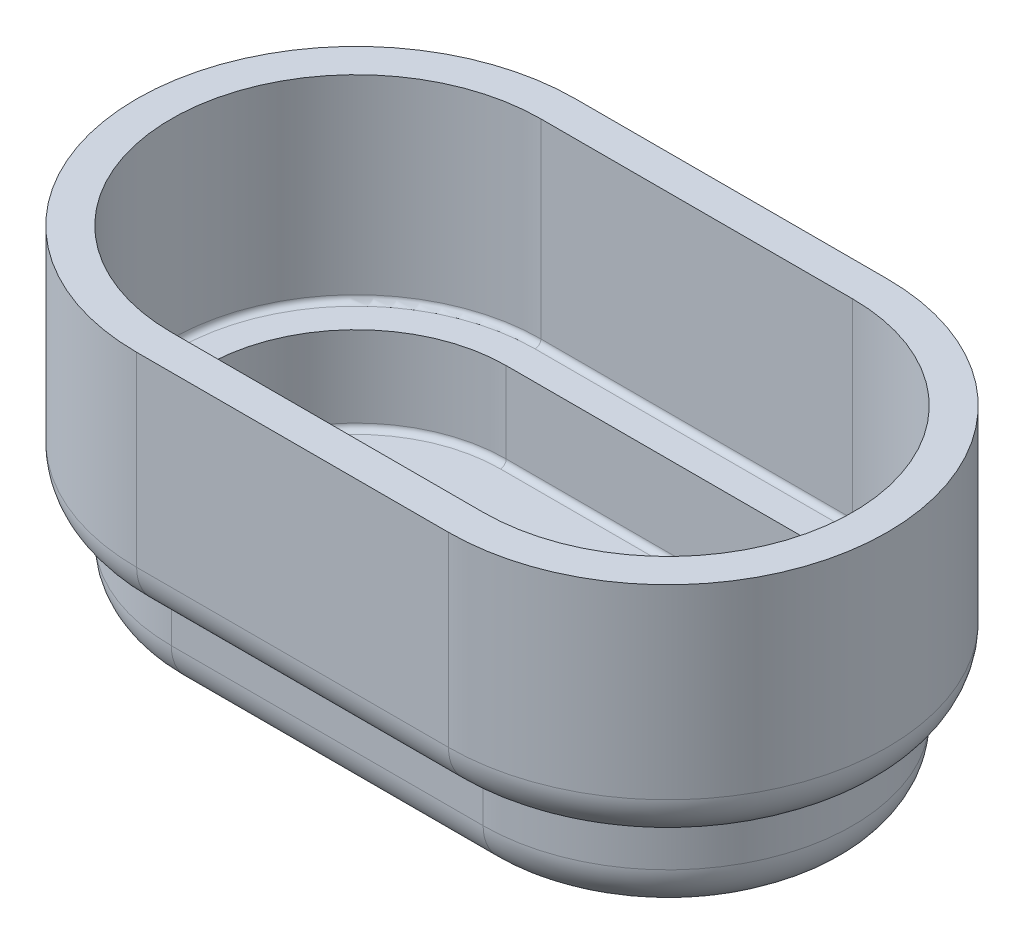
from build123d import *

# Parameters (mm, degrees)
EXTRUDE_1_DEPTH = 40
EXTRUDE_2_DEPTH = 55
SHELL_1_T       = -6
FILLET_1_R      = 8
FILLET_3_R      = 1


with BuildPart() as part:
    # 스케치1 → 보스-돌출1 (new body)
    with BuildSketch(Plane(origin=(0, 0, 0), x_dir=(1, 0, 0), z_dir=(0, 1, 0))):
        with BuildLine():
            Line((-23.342939481, 38), (30.657060519, 38))
            ThreePointArc((30.657060519, 38), (68.657060519, 0), (30.657060519, -38))
            Line((30.657060519, -38), (-23.342939481, -38))
            ThreePointArc((-23.342939481, -38), (-61.342939481, 0), (-23.342939481, 38))
        make_face()
    extrude(amount=-EXTRUDE_1_DEPTH)

    # 스케치1<3> → 보스-돌출2 (add)
    with BuildSketch(Plane(origin=(0, 0, 0), x_dir=(1, 0, 0), z_dir=(0, 1, 0))):
        with BuildLine():
            Line((-23.342939481, 32), (30.657060519, 32))
            ThreePointArc((30.657060519, 32), (62.657060519, 0), (30.657060519, -32))
            Line((30.657060519, -32), (-23.342939481, -32))
            ThreePointArc((-23.342939481, -32), (-55.342939481, 0), (-23.342939481, 32))
        make_face()
    extrude(amount=-EXTRUDE_2_DEPTH)

    # 쉘1
    shell_1_openings = [part.faces().sort_by_distance(p)[0] for p in [
        (3.657060519, 0, 0),
    ]]
    offset(amount=SHELL_1_T, openings=shell_1_openings, kind=Kind.INTERSECTION)

    # 필렛1
    # the kernel refuses this fillet: 8 mm, written as the material it takes off along each edge
    with BuildSketch(Plane(origin=(30.657060519, -40, 0), x_dir=(0, 0, -1), z_dir=(-1, 0, 0))) as fillet_1_piece_1:
        with BuildLine():
            CenterArc((30, -7.745966692), FILLET_1_R, 0, 75.522487814)
            Line((32, 0), (32.04, 0.154919334))
            ThreePointArc((32.04, 0.154919334), (35, 0.16), (38, 0.16))
            Line((38, 0.16), (38.16, 0))
            Line((38.16, 0), (38.16, -7.745966692))
            Line((38.16, -7.745966692), (38, -7.745966692))
        make_face()
    revolve(axis=Axis((30.657060519, -40, 0), (0, -1, 0)), revolution_arc=180, mode=Mode.SUBTRACT)
    with BuildSketch(Plane(origin=(-23.342939481, -40, -38), x_dir=(0, 0, 1), z_dir=(1, 0, 0))) as fillet_1_piece_2:
        with BuildLine():
            CenterArc((8, -7.745966692), FILLET_1_R, 104.477512186, 75.522487814)
            Line((0, -7.745966692), (-0.16, -7.745966692))
            Line((-0.16, -7.745966692), (-0.16, 0))
            Line((-0.16, 0), (0, 0.16))
            ThreePointArc((0, 0.16), (3, 0.16), (5.96, 0.154919334))
            Line((5.96, 0.154919334), (6, 0))
        make_face()
    extrude(amount=54, mode=Mode.SUBTRACT)
    with BuildSketch(Plane(origin=(30.657060519, -55, 0), x_dir=(0, 0, -1), z_dir=(-1, 0, 0))) as fillet_1_piece_3:
        with BuildLine():
            CenterArc((32 - FILLET_1_R, -FILLET_1_R), FILLET_1_R, 0, 90)
            Line((32 - FILLET_1_R, 0), (32 - FILLET_1_R, FILLET_1_R * 0.02))
            Line((32 - FILLET_1_R, FILLET_1_R * 0.02), (32 + FILLET_1_R * 0.02, FILLET_1_R * 0.02))
            Line((32 + FILLET_1_R * 0.02, FILLET_1_R * 0.02), (32 + FILLET_1_R * 0.02, -FILLET_1_R))
            Line((32 + FILLET_1_R * 0.02, -FILLET_1_R), (32, -FILLET_1_R))
        make_face()
    revolve(axis=Axis((30.657060519, -55, 0), (0, -1, 0)), revolution_arc=180, mode=Mode.SUBTRACT)
    with BuildSketch(Plane(origin=(30.657060519, -55, 32), x_dir=(0, 1, 0), z_dir=(-1, 0, 0)), Plane(origin=(-23.342939481, -55, -32), x_dir=(0, 1, 0), z_dir=(1, 0, 0))) as fillet_1_piece_4:
        with BuildLine():
            CenterArc((FILLET_1_R, FILLET_1_R), FILLET_1_R, 180, 90)
            Line((0, FILLET_1_R), (-FILLET_1_R * 0.02, FILLET_1_R))
            Line((-FILLET_1_R * 0.02, FILLET_1_R), (-FILLET_1_R * 0.02, -FILLET_1_R * 0.02))
            Line((-FILLET_1_R * 0.02, -FILLET_1_R * 0.02), (FILLET_1_R, -FILLET_1_R * 0.02))
            Line((FILLET_1_R, -FILLET_1_R * 0.02), (FILLET_1_R, 0))
        make_face()
    extrude(amount=54, mode=Mode.SUBTRACT)
    with BuildSketch(Plane(origin=(-23.342939481, -55, 0), x_dir=(0, 0, 1), z_dir=(1, 0, 0))) as fillet_1_piece_5:
        with BuildLine():
            CenterArc((32 - FILLET_1_R, -FILLET_1_R), FILLET_1_R, 0, 90)
            Line((32 - FILLET_1_R, 0), (32 - FILLET_1_R, FILLET_1_R * 0.02))
            Line((32 - FILLET_1_R, FILLET_1_R * 0.02), (32 + FILLET_1_R * 0.02, FILLET_1_R * 0.02))
            Line((32 + FILLET_1_R * 0.02, FILLET_1_R * 0.02), (32 + FILLET_1_R * 0.02, -FILLET_1_R))
            Line((32 + FILLET_1_R * 0.02, -FILLET_1_R), (32, -FILLET_1_R))
        make_face()
    revolve(axis=Axis((-23.342939481, -55, 0), (0, -1, 0)), revolution_arc=180, mode=Mode.SUBTRACT)
    with BuildSketch(Plane(origin=(-23.342939481, -40, 0), x_dir=(0, 0, 1), z_dir=(1, 0, 0))) as fillet_1_piece_6:
        with BuildLine():
            CenterArc((30, -7.745966692), FILLET_1_R, 0, 75.522487814)
            Line((32, 0), (32.04, 0.154919334))
            ThreePointArc((32.04, 0.154919334), (35, 0.16), (38, 0.16))
            Line((38, 0.16), (38.16, 0))
            Line((38.16, 0), (38.16, -7.745966692))
            Line((38.16, -7.745966692), (38, -7.745966692))
        make_face()
    revolve(axis=Axis((-23.342939481, -40, 0), (0, -1, 0)), revolution_arc=180, mode=Mode.SUBTRACT)
    with BuildSketch(Plane(origin=(30.657060519, -40, 38), x_dir=(0, 1, 0), z_dir=(-1, 0, 0))) as fillet_1_piece_7:
        with BuildLine():
            CenterArc((7.745966692, 8), FILLET_1_R, 194.477512186, 75.522487814)
            Line((0, 6), (-0.154919334, 5.96))
            ThreePointArc((-0.154919334, 5.96), (-0.16, 3), (-0.16, 0))
            Line((-0.16, 0), (0, -0.16))
            Line((0, -0.16), (7.745966692, -0.16))
            Line((7.745966692, -0.16), (7.745966692, 0))
        make_face()
    extrude(amount=54, mode=Mode.SUBTRACT)

    # 필렛3
    fillet_3_edges = [part.edges().sort_by_distance(p)[0] for p in [
        (3.657060519, -34, -32),
        (-55.342939481, -34, 0),
        (62.657060519, -34, 0),
        (3.657060519, -34, 32),
        (56.657060519, -49, 0),
        (3.657060519, -49, 26),
        (-49.342939481, -49, 0),
        (3.657060519, -49, -26),
    ]]
    fillet(fillet_3_edges, radius=FILLET_3_R)


solid = part.part
